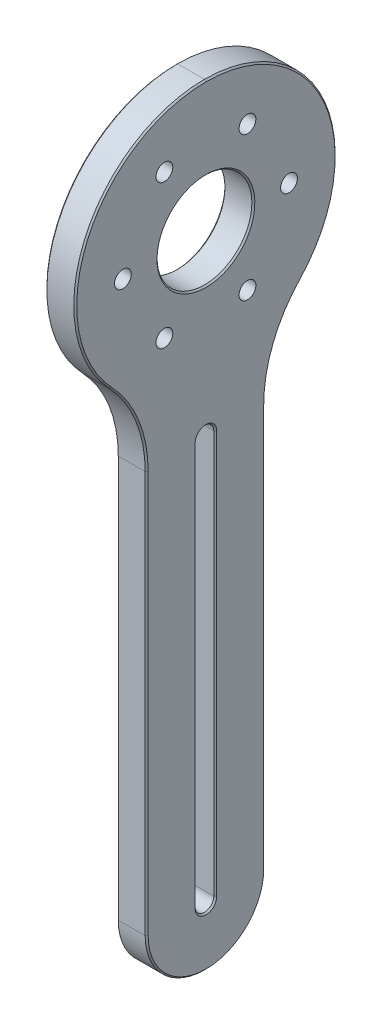
from build123d import *

# Parameters (mm, degrees)
SKETCH1_W                                           = 8
SKETCH1_H                                           = 105
BASE_DEPTH                                          = 35
CSK_FOR_M4_COUNTERSUNK_FLAT_HEAD_SCREW2_D           = 4.5
CSK_FOR_M4_COUNTERSUNK_FLAT_HEAD_SCREW2_CSINK_D     = 9.4
CSK_FOR_M4_COUNTERSUNK_FLAT_HEAD_SCREW2_CSINK_ANGLE = 90
FILLET1_R                                           = 35
SKETCH8_W                                           = 8
SKETCH8_H                                           = 70
BOSS_EXTRUDE1_DEPTH                                 = 101.6
CUT_EXTRUDE1_REACH                                  = 112.968
CUT_EXTRUDE2_DEPTH                                  = 111.968463989
FILLET2_R                                           = 34.925
FILLET3_R                                           = 15.875
SKETCH12_R                                          = 12.7
CUT_EXTRUDE4_DEPTH                                  = 111.968463989
CHAMFER1_SIZE                                       = 0.396875


with BuildPart() as part:
    # Sketch1 → base (new, symmetric)
    with BuildSketch(Plane.XY):
        with Locations((4, 52.5)):
            Rectangle(SKETCH1_W, SKETCH1_H)
    extrude(amount=BASE_DEPTH, both=True)

    # CSK for M4 Countersunk Flat Head Screw2 (through all)
    with Locations(Plane.ZY):
        with Locations((-11.125, 50.730934766), (-22.25, 70), (-11.125, 89.269065234), (11.125, 89.269065234), (22.25, 70), (11.125, 50.730934766)):
            CounterSinkHole(CSK_FOR_M4_COUNTERSUNK_FLAT_HEAD_SCREW2_D / 2, CSK_FOR_M4_COUNTERSUNK_FLAT_HEAD_SCREW2_CSINK_D / 2, counter_sink_angle=CSK_FOR_M4_COUNTERSUNK_FLAT_HEAD_SCREW2_CSINK_ANGLE)

    # Fillet1
    fillet1_edges = [part.edges().sort_by_distance(p)[0] for p in [
        (4, 105, 35),
        (4, 105, -35),
    ]]
    fillet(fillet1_edges, radius=FILLET1_R - 0.0001)  # a hair under: the kernel refuses the full size

    # Sketch8 → Boss-Extrude1 (add)
    with BuildSketch(Plane.XZ):
        with Locations((4, 0)):
            Rectangle(SKETCH8_W, SKETCH8_H)
    extrude(amount=BOSS_EXTRUDE1_DEPTH)

    # Sketch9 → Cut-Extrude1 (cut, up to next)
    with BuildSketch(Plane.ZY, mode=Mode.PRIVATE) as cut_extrude1_sk1:
        with BuildLine():
            Line((2.5, 22.225), (2.5, -85.725))
            ThreePointArc((2.5, -85.725), (0, -88.225), (-2.5, -85.725))
            Line((-2.5, -85.725), (-2.5, 22.225))
            ThreePointArc((-2.5, 22.225), (0, 24.725), (2.5, 22.225))
        make_face()
    cut_extrude1_tool1 = extrude(cut_extrude1_sk1.sketch, amount=-CUT_EXTRUDE1_REACH, mode=Mode.PRIVATE) & part.part
    add(cut_extrude1_tool1.solids().sort_by_distance((0, -31.75, 0))[0], mode=Mode.SUBTRACT)

    # Sketch10 → Cut-Extrude2 (cut, through all)
    with BuildSketch(Plane(origin=(8, 0, 0), x_dir=(0, 0, -1), z_dir=(1, 0, 0))):
        with BuildLine():
            Line((15.875, 38.807302537), (15.875, -101.6))
            Line((15.875, -101.6), (35, -101.6))
            Line((35, -101.6), (35, 70))
            ThreePointArc((35, 70), (29.838104833, 51.705533624), (15.875, 38.807302537))
        make_face()
        with BuildLine():
            Line((-35, -101.6), (-15.875, -101.6))
            Line((-15.875, -101.6), (-15.875, 38.807302537))
            ThreePointArc((-15.875, 38.807302537), (-29.838104833, 51.705533624), (-35, 70))
            Line((-35, 70), (-35, -101.6))
        make_face()
    extrude(amount=-CUT_EXTRUDE2_DEPTH, mode=Mode.SUBTRACT)

    # Fillet2
    fillet2_edges = [part.edges().sort_by_distance(p)[0] for p in [
        (4, 38.807302537, -15.875),
        (4, 38.807302537, 15.875),
    ]]
    fillet(fillet2_edges, radius=FILLET2_R)

    # Fillet3
    fillet3_edges = [part.edges().sort_by_distance(p)[0] for p in [
        (4, -101.6, -15.875),
        (4, -101.6, 15.875),
    ]]
    fillet(fillet3_edges, radius=FILLET3_R - 0.0001)  # a hair under: the kernel refuses the full size

    # Sketch12 → Cut-Extrude4 (cut, through all)
    with BuildSketch(Plane.ZY):
        with Locations(Location((0, 70, 0), (0, 0, 270))):
            Circle(SKETCH12_R)
    extrude(amount=-CUT_EXTRUDE4_DEPTH, mode=Mode.SUBTRACT)

    # Chamfer1
    chamfer1_edges = [part.edges().sort_by_distance(p)[0] for p in [
        (8, 94.748766631, -24.748766631),
        (0, 94.748766631, 24.748766631),
        (8, 34.864684854, -18.350815522),
        (0, 34.864684854, -18.350815522),
        (8, 34.864684854, 18.350815522),
        (0, 34.864684854, 18.350815522),
        (8, -31.887878432, -15.875),
        (8, -31.887878432, 15.875),
        (8, -96.950349441, 11.225349441),
        (8, -96.950349441, -11.225349441),
        (0, -31.887878432, -15.875),
        (0, -31.887878432, 15.875),
        (0, -96.950349441, 11.225349441),
        (0, -96.950349441, -11.225349441),
        (8, 82.7, 0),
        (0, 82.7, 0),
        (0, 94.748766631, -24.748766631),
        (8, 94.748766631, 24.748766631),
        (0, 24.725, 0),
        (0, -31.75, -2.5),
        (0, -88.225, 0),
        (0, -31.75, 2.5),
        (8, -31.75, -2.5),
        (8, 24.725, 0),
        (8, -31.75, 2.5),
        (8, -88.225, 0),
    ]]
    chamfer(chamfer1_edges, length=CHAMFER1_SIZE)


solid = part.part
